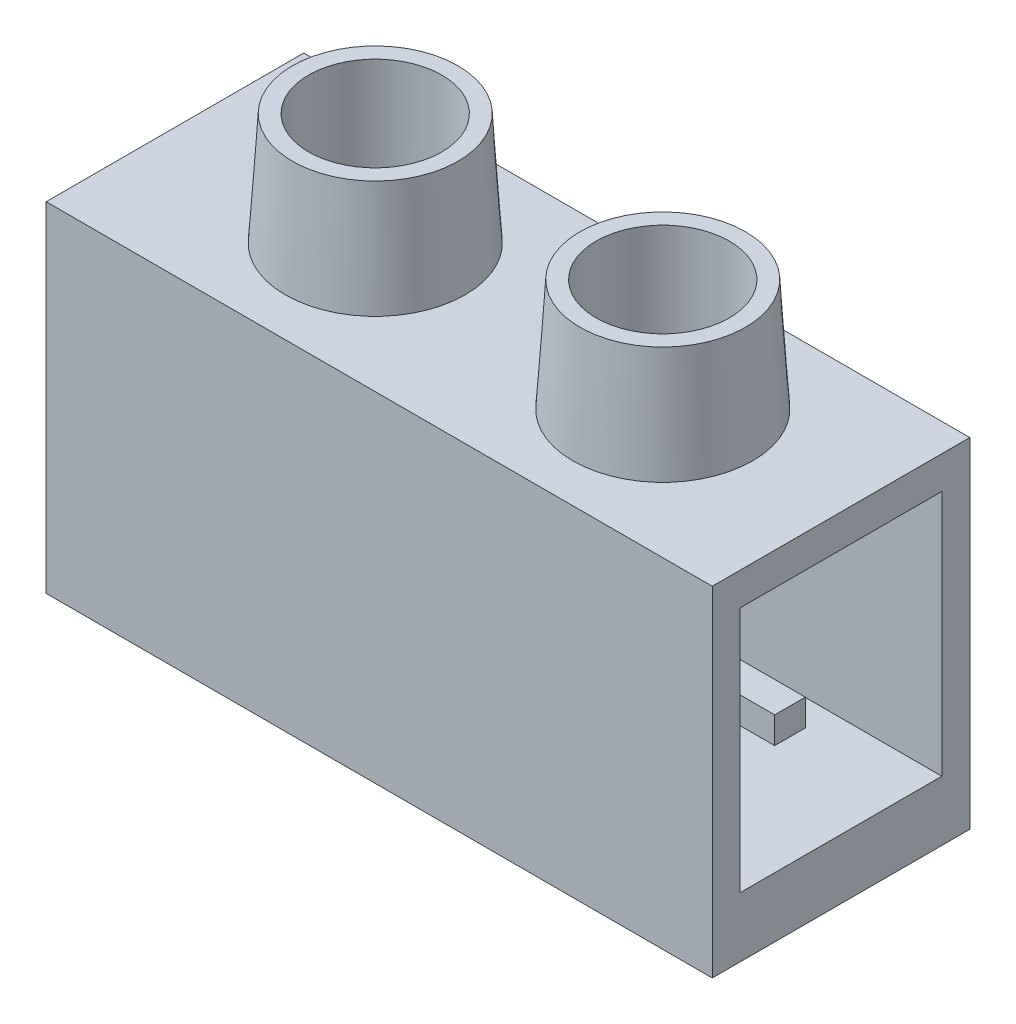
from build123d import *

# Parameters (mm, degrees)
BOSS_EXTRUDE1_DEPTH = 15.28
SKETCH2_R           = 4.05
BOSS_EXTRUDE2_DEPTH = 9.72
CHAMFER1_SIZE       = 9.72
CHAMFER1_SIZE_2     = 0.62
CHAMFER2_SIZE       = 9.72
CHAMFER2_SIZE_2     = 0.62
SKETCH4_W           = 9.08
SKETCH4_H           = 11.11
CUT_EXTRUDE1_DEPTH  = 30
SKETCH6_W           = 1.5
SKETCH6_H           = 3
SKETCH6_W_2         = 1.57
SKETCH6_W_3         = 1.38
SKETCH6_H_2         = 1.2
BOSS_EXTRUDE3_DEPTH = 25.04233017
SKETCH7_W           = 1.5
SKETCH7_H           = 3
CUT_EXTRUDE2_DEPTH  = 19.72
SKETCH8_R           = 3
CUT_EXTRUDE3_DEPTH  = 11.19
SKETCH9_W           = 11.6
SKETCH9_H           = 4.67
CUT_EXTRUDE4_DEPTH  = 32


with BuildPart() as part:
    # Sketch1 → Boss-Extrude1 (new body)
    with BuildSketch(Plane(origin=(0, 0, 0), x_dir=(1, 0, 0), z_dir=(0, 1, 0))):
        Polygon((-3.25, 5.8), (-15, 5.8), (-15, -5.8), (15, -5.8), (15, 5.8), (3.25, 5.8), align=None)
    extrude(amount=BOSS_EXTRUDE1_DEPTH)

    # Sketch2 → Boss-Extrude2 (add)
    with BuildSketch(Plane(origin=(0, 15.28, 0), x_dir=(1, 0, 0), z_dir=(0, 1, 0))):
        with Locations(Location((-5.98, 0, 0), (0, 0, 270))):
            Circle(SKETCH2_R)
        with Locations(Location((6.97, 0, 0), (0, 0, 270))):
            Circle(SKETCH2_R)
    extrude(amount=BOSS_EXTRUDE2_DEPTH)

    # Chamfer1
    # the kernel refuses this chamfer: 9.72, 0.62 mm, written as the material it takes off along each edge
    with BuildSketch(Plane(origin=(-5.98, 25, 0), x_dir=(0, 0, 1), z_dir=(-1, 0, 0))) as chamfer1_piece_1_section:
        Polygon((4.05, -CHAMFER1_SIZE), (4.05 - CHAMFER1_SIZE_2, 0), (4.05, 0), align=None)
    chamfer1_piece_1 = revolve(axis=Axis((-5.98, 25, 0), (0, 1, 0)), mode=Mode.PRIVATE)
    chamfer1_piece_1 = split(chamfer1_piece_1, bisect_by=Plane(origin=(-5.98, 15.28, -3.777775081), z_dir=(0, 1, 0)), keep=Keep.TOP, mode=Mode.PRIVATE)
    add(chamfer1_piece_1, mode=Mode.SUBTRACT)

    # Chamfer2
    # the kernel refuses this chamfer: 9.72, 0.62 mm, written as the material it takes off along each edge
    with BuildSketch(Plane(origin=(6.97, 25, 0), x_dir=(0, 0, 1), z_dir=(-1, 0, 0))) as chamfer2_piece_1_section:
        Polygon((4.05, -CHAMFER2_SIZE), (4.05 - CHAMFER2_SIZE_2, 0), (4.05, 0), align=None)
    chamfer2_piece_1 = revolve(axis=Axis((6.97, 25, 0), (0, 1, 0)), mode=Mode.PRIVATE)
    chamfer2_piece_1 = split(chamfer2_piece_1, bisect_by=Plane(origin=(6.97, 15.28, -3.777775081), z_dir=(0, 1, 0)), keep=Keep.TOP, mode=Mode.PRIVATE)
    add(chamfer2_piece_1, mode=Mode.SUBTRACT)

    # Sketch4 → Cut-Extrude1 (cut)
    with BuildSketch(Plane(origin=(15, 0, 0), x_dir=(0, 0, -1), z_dir=(1, 0, 0))):
        with Locations((0, 8.255)):
            Rectangle(SKETCH4_W, SKETCH4_H)
    extrude(amount=-CUT_EXTRUDE1_DEPTH, mode=Mode.SUBTRACT)

    # Sketch6 → Boss-Extrude3 (add)
    with BuildSketch(Plane.ZY.offset(15)):
        with Locations((0, 12.31)):
            Rectangle(SKETCH6_W, SKETCH6_H)
        with Locations((-3.755, 12.31)):
            Rectangle(SKETCH6_W_2, SKETCH6_H)
        with Locations((-2.66, 3.3)):
            Rectangle(SKETCH6_W_3, SKETCH6_H_2)
        with Locations((2.66, 3.3)):
            Rectangle(SKETCH6_W_3, SKETCH6_H_2)
        with Locations((3.755, 12.31)):
            Rectangle(SKETCH6_W_2, SKETCH6_H)
    extrude(amount=-BOSS_EXTRUDE3_DEPTH)

    # Sketch7 → Cut-Extrude2 (cut)
    with BuildSketch(Plane(origin=(10.04233017, 0, 0), x_dir=(0, 0, -1), z_dir=(1, 0, 0))):
        with Locations((0, 12.31)):
            Rectangle(SKETCH7_W, SKETCH7_H)
    extrude(amount=-CUT_EXTRUDE2_DEPTH, mode=Mode.SUBTRACT)

    # Sketch8 → Cut-Extrude3 (cut)
    with BuildSketch(Plane(origin=(0, 25, 0), x_dir=(1, 0, 0), z_dir=(0, 1, 0))):
        with Locations(Location((6.97, 0, 0), (0, 0, 270))):
            Circle(SKETCH8_R)
        with Locations(Location((-5.98, 0, 0), (0, 0, 270))):
            Circle(SKETCH8_R)
    extrude(amount=-CUT_EXTRUDE3_DEPTH, mode=Mode.SUBTRACT)

    # Sketch9 → Cut-Extrude4 (cut)
    with BuildSketch(Plane.ZY.offset(15)):
        with Locations((0, 22.665)):
            Rectangle(SKETCH9_W, SKETCH9_H)
    extrude(amount=-CUT_EXTRUDE4_DEPTH, mode=Mode.SUBTRACT)


solid = part.part
